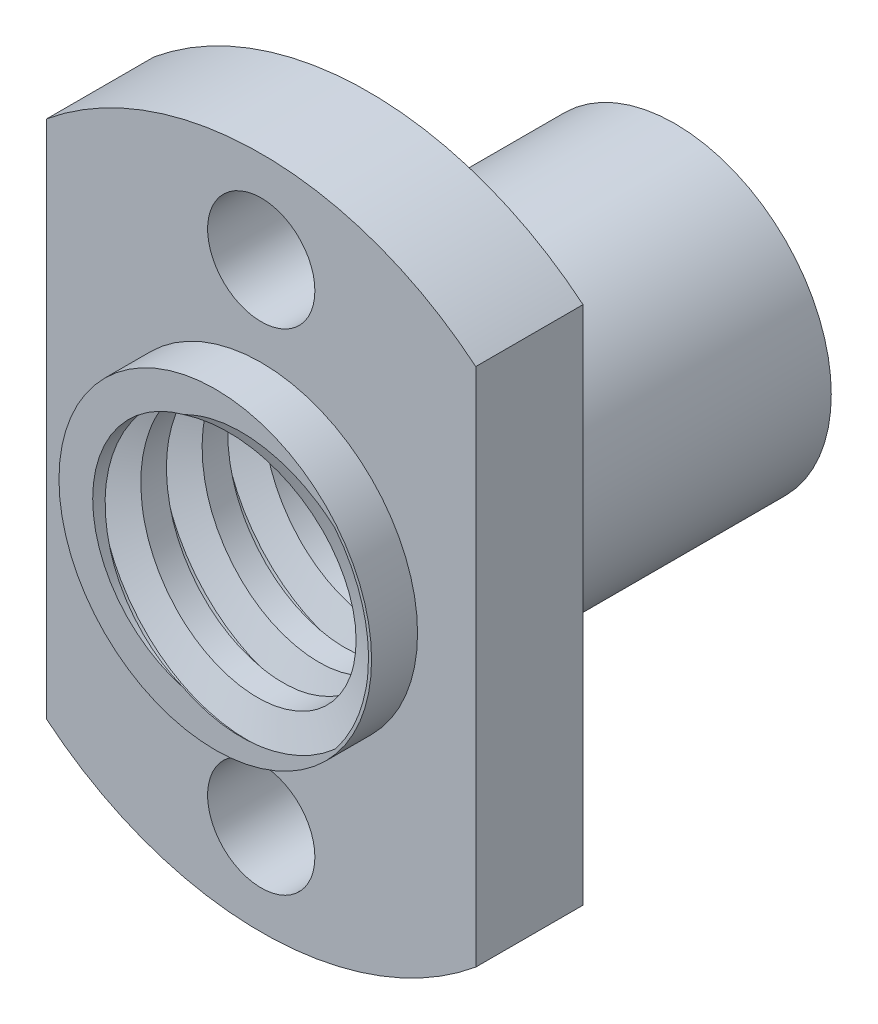
from build123d import *

# Parameters (mm, degrees)
SKETCH1_R                = 5.1
SKETCH1_R_2              = 1.75
BOSS_EXTRUDE1_DEPTH      = 3.5
BOSS_EXTRUDE2_DEPTH      = 1.5
BOSS_EXTRUDE2_DEPTH_BACK = 13.5
SKETCH2_R                = 5.1
SKETCH2_R_2              = 4
CUT_SWEEP1_PITCH         = 2


with BuildPart() as part:
    # Sketch1 → Boss-Extrude1 (new body)
    with BuildSketch(Plane.XY):
        with BuildLine():
            Line((-7, -8.485281374), (-7, 8.485281374))
            ThreePointArc((-7, 8.485281374), (0, 11), (7, 8.485281374))
            Line((7, 8.485281374), (7, -8.485281374))
            ThreePointArc((7, -8.485281374), (0, -11), (-7, -8.485281374))
        make_face()
        Circle(SKETCH1_R, mode=Mode.SUBTRACT)
        with Locations((0, 8)):
            Circle(SKETCH1_R_2, mode=Mode.SUBTRACT)
        with Locations((0, -8)):
            Circle(SKETCH1_R_2, mode=Mode.SUBTRACT)
    extrude(amount=-BOSS_EXTRUDE1_DEPTH)

    # Sketch2 → Boss-Extrude2 (add, two sides: drawn at the far end of the back side and taken through both)
    with BuildSketch(Plane.XY.offset(-BOSS_EXTRUDE2_DEPTH_BACK)):
        Circle(SKETCH2_R)
        Circle(SKETCH2_R_2, mode=Mode.SUBTRACT)
    extrude(amount=BOSS_EXTRUDE2_DEPTH + BOSS_EXTRUDE2_DEPTH_BACK)

    # Cut-Sweep1: arcs per turn and ends read off the stored shape
    # Cut-Sweep1: the profile of Sketch4 screwed along a right-hand helix through 9 turns, 10 arcs to a turn; built about Z, then put on its axis
    cut_sweep1_z = Axis((0, 0, 0), (0, 0, 1))
    cut_sweep1_corners = [(3, 0, -1.05), (3, 0, -2.95), (5, 0, -2.214588815), (5, 0, -1.785411185)]
    with BuildLine(mode=Mode.PRIVATE) as cut_sweep1_profile:
        Line(cut_sweep1_corners[0], cut_sweep1_corners[1])
        Line(cut_sweep1_corners[1], cut_sweep1_corners[2])
        Line(cut_sweep1_corners[2], cut_sweep1_corners[3])
        Line(cut_sweep1_corners[3], cut_sweep1_corners[0])
    cut_sweep1_cap = Face(cut_sweep1_profile.wire())
    cut_sweep1_turn_angles = [0, 18, 36, 54, 72, 90, 108, 126, 144, 162, 180, 198, 216, 234, 252, 270, 288, 306, 324, 342, 360]
    cut_sweep1_turn_weights = [1, 0.9510565162951535, 1, 0.9510565162951535, 1, 0.9510565162951535, 1, 0.9510565162951535, 1, 0.9510565162951535, 1, 0.9510565162951535, 1, 0.9510565162951535, 1, 0.9510565162951535, 1, 0.9510565162951535, 1, 0.9510565162951535, 1]
    cut_sweep1_turn_rails = [Edge.make_bspline([Vector(p[0], p[1], 0).rotate(cut_sweep1_z, cut_sweep1_turn_angles[k]) / cut_sweep1_turn_weights[k] + Vector(0, 0, p[2] + CUT_SWEEP1_PITCH * cut_sweep1_turn_angles[k] / 360) for k in range(21)], [0, 0, 0, 1, 1, 2, 2, 3, 3, 4, 4, 5, 5, 6, 6, 7, 7, 8, 8, 9, 9, 10, 10, 10], 2, cut_sweep1_turn_weights) for p in cut_sweep1_corners]
    cut_sweep1_turn_sides = [Face.make_surface_from_curves(cut_sweep1_turn_rails[p[0]], cut_sweep1_turn_rails[p[1]]) for p in [(0, 1), (1, 2), (2, 3), (3, 0)]]
    cut_sweep1 = Plane(origin=(0, 0, 1.5), x_dir=(1, 0, 0), z_dir=(0, 0, -1)) * Solid(Shell([*[p.moved(Location((0, 0, CUT_SWEEP1_PITCH * i))) for i in range(9) for p in cut_sweep1_turn_sides], cut_sweep1_cap, cut_sweep1_cap.rotate(cut_sweep1_z, 3240).moved(Location((0, 0, CUT_SWEEP1_PITCH * 3240 / 360)))]))
    add(cut_sweep1, mode=Mode.SUBTRACT)


solid = part.part
